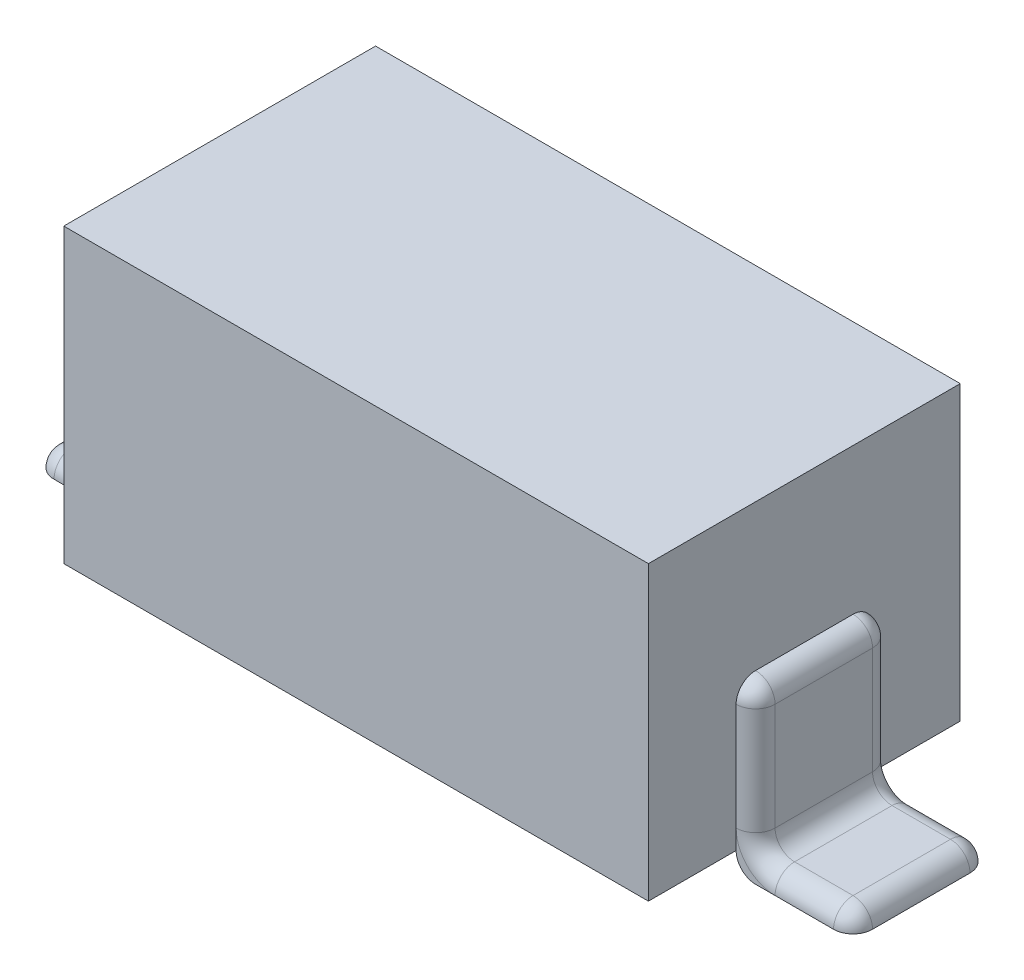
from build123d import *

# Parameters (mm, degrees)
SKETCH1_W            = 3
SKETCH1_H            = 1.6
BOSS_EXTRUDE1_DEPTH  = 0.75
SKETCH2_W            = 0.7
SKETCH2_H            = 0.85
BOSS_EXTRUDE2_DEPTH  = 0.1
SKETCH5_W            = 0.7
SKETCH5_H            = 0.1
BOSS_EXTRUDE4_DEPTH  = 0.5
FILLET4_R            = 0.1
FILLET4_OF_MIRROR1_R = 0.1


with BuildPart() as part:
    # Sketch1 → Boss-Extrude1 (new, symmetric)
    with BuildSketch(Plane(origin=(0, 0, 0), x_dir=(1, 0, 0), z_dir=(0, 1, 0))):
        Rectangle(SKETCH1_W, SKETCH1_H)
    extrude(amount=BOSS_EXTRUDE1_DEPTH, both=True)

    # Sketch2 → Boss-Extrude2 (add)
    with BuildSketch(Plane(origin=(1.5, 0, 0), x_dir=(0, 0, -1), z_dir=(1, 0, 0))):
        with Locations((0, -0.425)):
            Rectangle(SKETCH2_W, SKETCH2_H)
    boss_extrude2 = extrude(amount=BOSS_EXTRUDE2_DEPTH)

    # Sketch5 → Boss-Extrude4 (add)
    with BuildSketch(Plane(origin=(1.6, 0, 0), x_dir=(0, 0, -1), z_dir=(1, 0, 0))):
        with Locations((0, -0.8)):
            Rectangle(SKETCH5_W, SKETCH5_H)
    boss_extrude4 = extrude(amount=BOSS_EXTRUDE4_DEPTH)

    # Fillet4
    fillet4_edges = [part.edges().sort_by_distance(p)[0] for p in [
        (1.6, -0.75, 0),
    ]]
    fillet(fillet4_edges, radius=FILLET4_R)
    fillet4_2_edges = [part.edges().sort_by_distance(p)[0] for p in [
        (2.1, -0.75, 0),
        (1.6, 0, 0),
        (1.5, -0.85, 0),
    ]]
    fillet(fillet4_2_edges, radius=FILLET4_R - 0.0001)  # a hair under: the kernel refuses the full size
    fillet4_3_edges = [part.edges().sort_by_distance(p)[0] for p in [
        (1.85005, -0.75, -0.35),
        (1.85005, -0.75, 0.35),
        (1.6, -0.37495, -0.35),
        (1.6, -0.37495, 0.35),
        (1.570739967, -0.029260033, 0.35),
        (1.629289322, -0.720710678, 0.35),
        (1.629289322, -0.720710678, -0.35),
        (1.570739967, -0.029260033, -0.35),
        (2.070739967, -0.779260033, 0.35),
        (2.070739967, -0.779260033, -0.35),
    ]]
    fillet(fillet4_3_edges, radius=FILLET4_R - 0.0001)  # a hair under: the kernel refuses the full size

    # Mirror1: Boss-Extrude2, Boss-Extrude4 across plane
    add(boss_extrude2.mirror(Plane(origin=(0, 0, 0), x_dir=(0, 0, 1), z_dir=(1, 0, 0))))
    add(boss_extrude4.mirror(Plane(origin=(0, 0, 0), x_dir=(0, 0, 1), z_dir=(1, 0, 0))))

    # Fillet4 of Mirror1
    fillet4_of_mirror1_edges = [part.edges().sort_by_distance(p)[0] for p in [
        (-1.6, -0.75, 0),
    ]]
    fillet(fillet4_of_mirror1_edges, radius=FILLET4_OF_MIRROR1_R)
    fillet4_of_mirror1_2_edges = [part.edges().sort_by_distance(p)[0] for p in [
        (-2.1, -0.75, 0),
        (-1.6, 0, 0),
        (-1.5, -0.85, 0),
    ]]
    fillet(fillet4_of_mirror1_2_edges, radius=FILLET4_OF_MIRROR1_R - 0.0001)  # a hair under: the kernel refuses the full size
    fillet4_of_mirror1_3_edges = [part.edges().sort_by_distance(p)[0] for p in [
        (-1.85005, -0.75, -0.35),
        (-1.85005, -0.75, 0.35),
        (-1.6, -0.37495, -0.35),
        (-1.6, -0.37495, 0.35),
        (-1.570739967, -0.029260033, 0.35),
        (-1.629289322, -0.720710678, 0.35),
        (-1.629289322, -0.720710678, -0.35),
        (-1.570739967, -0.029260033, -0.35),
        (-2.070739967, -0.779260033, 0.35),
        (-2.070739967, -0.779260033, -0.35),
    ]]
    fillet(fillet4_of_mirror1_3_edges, radius=FILLET4_OF_MIRROR1_R - 0.0001)  # a hair under: the kernel refuses the full size


solid = part.part
